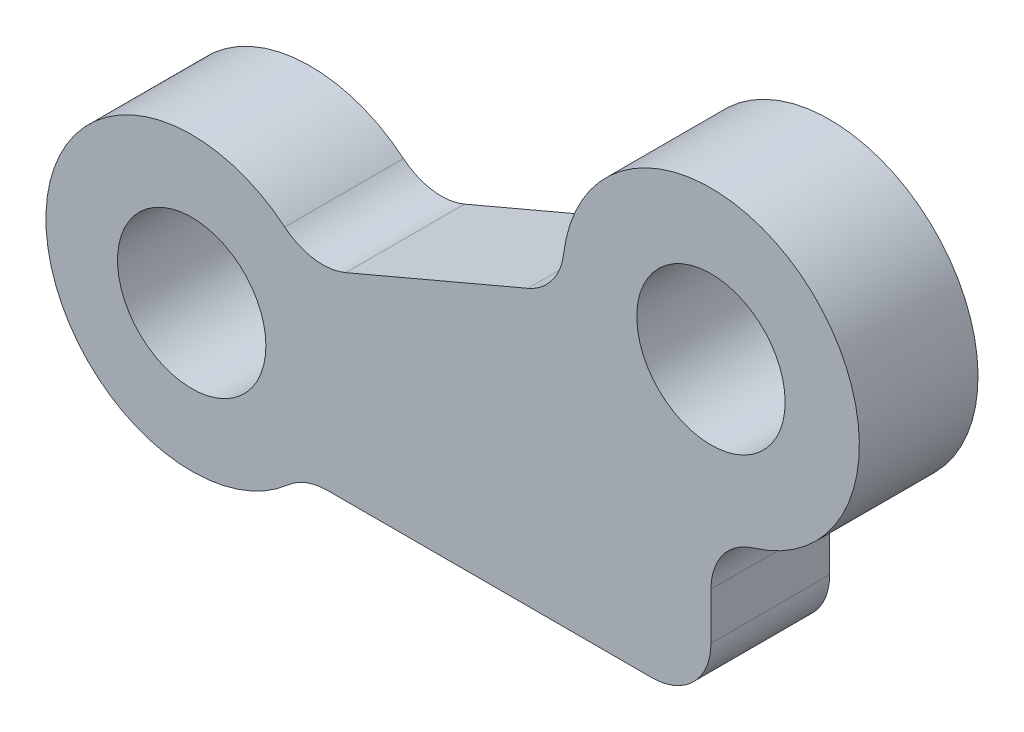
from build123d import *

# Parameters (mm, degrees)
SKETCH1_R           = 2.5
BOSS_EXTRUDE1_DEPTH = 4
FILLET1_R           = 2


with BuildPart() as part:
    # Sketch1 → Boss-Extrude1 (new body)
    with BuildSketch(Plane.XY):
        with BuildLine():
            Line((56.839071038, 28.579919803), (56.839071038, 23.292312115))
            Line((56.839071038, 23.292312115), (43.08257304, 23.292312115))
            ThreePointArc((43.08257304, 23.292312115), (34.429928081, 26.628647856), (43.273147001, 29.420937259))
            Line((43.273147001, 29.420937259), (51.8645252, 33.076041142))
            ThreePointArc((51.8645252, 33.076041142), (60.191727201, 37.289326312), (56.839071038, 28.579919803))
        make_face()
        with Locations((39.340592987, 26.475947236)):
            Circle(SKETCH1_R, mode=Mode.SUBTRACT)
        with Locations((56.839071038, 33.579919803)):
            Circle(SKETCH1_R, mode=Mode.SUBTRACT)
    extrude(amount=BOSS_EXTRUDE1_DEPTH)

    # Fillet1
    fillet1_edges = [part.edges().sort_by_distance(p)[0] for p in [
        (43.08257304, 23.292312115, 2),
        (56.839071038, 23.292312115, 2),
        (56.839071038, 28.579919803, 2),
        (43.273147001, 29.420937259, 2),
        (51.8645252, 33.076041142, 2),
    ]]
    fillet(fillet1_edges, radius=FILLET1_R)


solid = part.part
